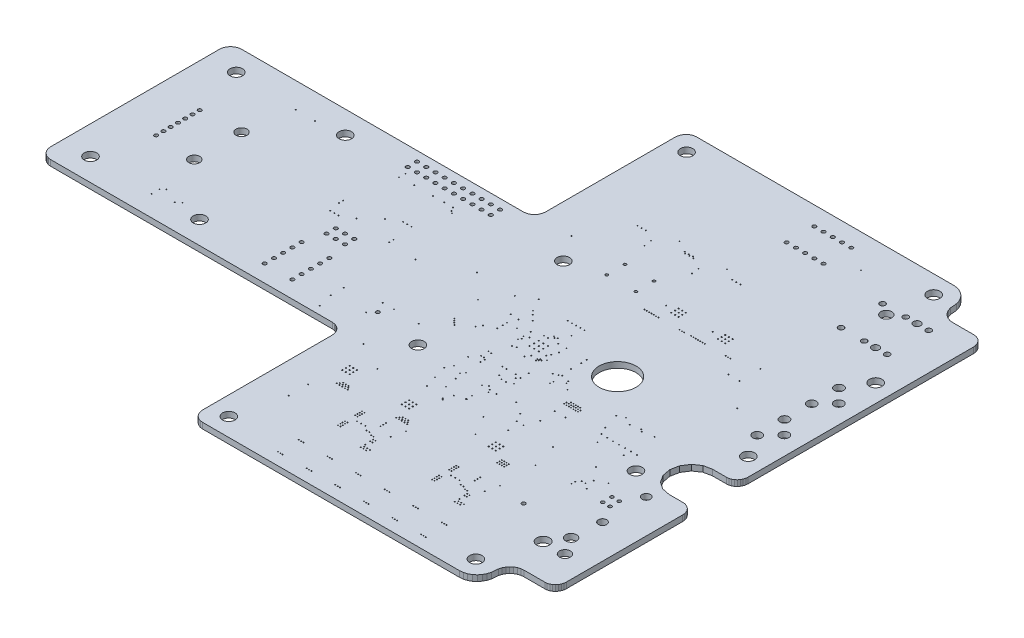
from build123d import *

# Parameters (mm, degrees)
BOARD_OUTLINE_DEPTH = 1.6
SKETCH2_R           = 5.08
SKETCH2_R_2         = 1.15
SKETCH2_R_3         = 1
SKETCH2_R_4         = 1.5
SKETCH2_R_5         = 0.127
SKETCH2_R_6         = 0.508
SKETCH2_R_7         = 0.1905
SKETCH2_R_8         = 1.7145
NPTH_DEPTH          = 116.781160961
SKETCH3_R           = 0.375
SKETCH3_R_2         = 1.75
SKETCH3_R_3         = 1.5
SKETCH3_R_4         = 0.46
SKETCH3_R_5         = 0.75
SKETCH3_R_6         = 1.25
SKETCH3_R_7         = 0.51
SKETCH3_R_8         = 0.5
SKETCH3_R_9         = 0.15
PTH_DEPTH           = 116.781160961


with BuildPart() as part:
    # Sketch1 → Board_Outline (new body)
    with BuildSketch(Plane(origin=(0, 0, 0), x_dir=(1, 0, 0), z_dir=(0, 1, 0))):
        Polygon((90.797031, -59), (91.362359, -58.942359), (91.905959, -58.771641), (92.40695, -58.494409), (92.846069, -58.121319), (93.206441, -57.666709), (93.474219, -57.14805), (93.639131, -56.585269), (93.694809, -56), (93.694809, -24), (93.639131, -23.414731), (93.474219, -22.85195), (93.206441, -22.333291), (92.846069, -21.878681), (92.40695, -21.505591), (91.905959, -21.228359), (91.362359, -21.057641), (90.797031, -21), (86.933319, -21), (84.715459, -20.543281), (82.83525, -19.242641), (81.578931, -17.2961), (81.137769, -15), (81.578931, -12.7039), (82.83525, -10.757359), (84.715459, -9.456719), (86.933319, -9), (90.797031, -9), (91.362359, -8.942359), (91.905959, -8.771641), (92.40695, -8.494409), (92.846069, -8.121319), (93.206441, -7.666709), (93.474219, -7.14805), (93.639131, -6.585269), (93.694809, -6), (93.694809, 56), (93.639131, 56.585269), (93.474219, 57.14805), (93.206441, 57.666709), (92.846069, 58.121319), (92.40695, 58.494409), (91.905959, 58.771641), (91.362359, 58.942359), (90.797031, 59), (85.001469, 59), (84.2477, 59.076859), (83.5229, 59.304481), (82.854909, 59.674119), (82.269419, 60.171569), (81.788919, 60.777719), (81.431881, 61.469269), (81.212009, 62.219641), (81.137769, 63), (81.044969, 63.97545), (80.770141, 64.913419), (80.323831, 65.77785), (79.7232, 66.535531), (78.991341, 67.15735), (78.156359, 67.6194), (77.25035, 67.903931), (76.308141, 68), (5.518331, 68), (4.953, 67.942359), (4.4094, 67.771641), (3.908409, 67.494409), (3.469291, 67.121319), (3.108919, 66.666709), (2.841141, 66.14805), (2.676231, 65.585269), (2.62055, 65), (2.62055, 29.337), (2.516692, 28.54812), (2.212195, 27.813), (1.727811, 27.181739), (1.09655, 26.697355), (0.36143, 26.392858), (-0.42745, 26.289), (-77.978, 26.289), (-78.76688, 26.185142), (-79.502, 25.880645), (-80.133261, 25.396261), (-80.617645, 24.765), (-80.922142, 24.02988), (-81.026, 23.241), (-81.026, -23.241), (-80.922142, -24.02988), (-80.617645, -24.765), (-80.133261, -25.396261), (-79.502, -25.880645), (-78.76688, -26.185142), (-77.978, -26.289), (-0.42745, -26.289), (0.36143, -26.392858), (1.09655, -26.697355), (1.727811, -27.181739), (2.212195, -27.813), (2.516692, -28.54812), (2.62055, -29.337), (2.62055, -65), (2.676231, -65.585269), (2.841141, -66.14805), (3.108919, -66.666709), (3.469291, -67.121319), (3.908409, -67.494409), (4.4094, -67.771641), (4.953, -67.942359), (5.518331, -68), (76.308141, -68), (77.25035, -67.903931), (78.156359, -67.6194), (78.991341, -67.15735), (79.7232, -66.535531), (80.323831, -65.77785), (80.770141, -64.913419), (81.044969, -63.97545), (81.137769, -63), (81.212009, -62.219641), (81.431881, -61.469269), (81.788919, -60.777719), (82.269419, -60.171569), (82.854909, -59.674119), (83.5229, -59.304481), (84.2477, -59.076859), (85.001469, -59), align=None)
    extrude(amount=BOARD_OUTLINE_DEPTH)

    # Sketch2 → NPTH (cut, through all)
    with BuildSketch(Plane(origin=(0, 0, 0), x_dir=(1, 0, 0), z_dir=(0, 1, 0))):
        with Locations((51.786, 0)):
            Circle(SKETCH2_R)
        with Locations((84.391, -36.754)):
            Circle(SKETCH2_R_2)
        with Locations((84.391, -24.714)):
            Circle(SKETCH2_R_2)
        with Locations((80.366, 53.839)):
            Circle(SKETCH2_R_3)
        with Locations((80.366, 42.409)):
            Circle(SKETCH2_R_3)
        with Locations((74.016, 51.709)):
            Circle(SKETCH2_R_4)
        with Locations((29.591, -4.191)):
            Circle(SKETCH2_R_5)
        with Locations((29.972, -7.239)):
            Circle(SKETCH2_R_5)
        with Locations((47.244, -22.225)):
            Circle(SKETCH2_R_5)
        with Locations((29.206, -3.306)):
            Circle(SKETCH2_R_5)
        with Locations((29.174, -1.306)):
            Circle(SKETCH2_R_5)
        with Locations((29.19, -4.806)):
            Circle(SKETCH2_R_5)
        with Locations((34.163, -8.001)):
            Circle(SKETCH2_R_5)
        with Locations((38.136, -5.806)):
            Circle(SKETCH2_R_5)
        with Locations((37.993, -2.306)):
            Circle(SKETCH2_R_5)
        with Locations((38.025, -0.306)):
            Circle(SKETCH2_R_5)
        with Locations((34.417, 0.889)):
            Circle(SKETCH2_R_5)
        with Locations((33.909, 0.508)):
            Circle(SKETCH2_R_5)
        with Locations((33.405, 0.893)):
            Circle(SKETCH2_R_5)
        with Locations((55.753, -35.814)):
            Circle(SKETCH2_R_5)
        with Locations((56.388, -35.814)):
            Circle(SKETCH2_R_5)
        with Locations((55.753, -36.449)):
            Circle(SKETCH2_R_5)
        with Locations((56.388, -36.449)):
            Circle(SKETCH2_R_5)
        with Locations((55.753, -37.084)):
            Circle(SKETCH2_R_5)
        with Locations((56.388, -37.084)):
            Circle(SKETCH2_R_5)
        with Locations((57.023, -37.084)):
            Circle(SKETCH2_R_5)
        with Locations((57.023, -36.449)):
            Circle(SKETCH2_R_5)
        with Locations((57.023, -35.814)):
            Circle(SKETCH2_R_5)
        with Locations((57.658, -35.814)):
            Circle(SKETCH2_R_5)
        with Locations((57.658, -36.449)):
            Circle(SKETCH2_R_5)
        with Locations((57.658, -37.084)):
            Circle(SKETCH2_R_5)
        with Locations((50.8, -43.434)):
            Circle(SKETCH2_R_5)
        with Locations((51.435, -43.434)):
            Circle(SKETCH2_R_5)
        with Locations((50.8, -44.069)):
            Circle(SKETCH2_R_5)
        with Locations((51.435, -44.069)):
            Circle(SKETCH2_R_5)
        with Locations((51.435, -44.704)):
            Circle(SKETCH2_R_5)
        with Locations((50.8, -44.704)):
            Circle(SKETCH2_R_5)
        with Locations((50.8, -45.339)):
            Circle(SKETCH2_R_5)
        with Locations((51.435, -45.339)):
            Circle(SKETCH2_R_5)
        with Locations((61.595, -42.164)):
            Circle(SKETCH2_R_5)
        with Locations((35.687, -42.164)):
            Circle(SKETCH2_R_5)
        with Locations((24.892, -43.434)):
            Circle(SKETCH2_R_5)
        with Locations((25.527, -43.434)):
            Circle(SKETCH2_R_5)
        with Locations((24.892, -44.069)):
            Circle(SKETCH2_R_5)
        with Locations((24.892, -44.704)):
            Circle(SKETCH2_R_5)
        with Locations((24.892, -45.339)):
            Circle(SKETCH2_R_5)
        with Locations((25.527, -44.069)):
            Circle(SKETCH2_R_5)
        with Locations((25.527, -44.704)):
            Circle(SKETCH2_R_5)
        with Locations((25.527, -45.339)):
            Circle(SKETCH2_R_5)
        with Locations((14.732, -40.259)):
            Circle(SKETCH2_R_5)
        with Locations((15.113, -39.751)):
            Circle(SKETCH2_R_5)
        with Locations((15.494, -40.259)):
            Circle(SKETCH2_R_5)
        with Locations((15.875, -39.751)):
            Circle(SKETCH2_R_5)
        with Locations((16.256, -40.259)):
            Circle(SKETCH2_R_5)
        with Locations((16.637, -39.751)):
            Circle(SKETCH2_R_5)
        with Locations((17.018, -40.259)):
            Circle(SKETCH2_R_5)
        with Locations((17.399, -39.751)):
            Circle(SKETCH2_R_5)
        with Locations((17.78, -40.259)):
            Circle(SKETCH2_R_5)
        with Locations((17.018, -39.243)):
            Circle(SKETCH2_R_5)
        with Locations((16.256, -39.243)):
            Circle(SKETCH2_R_5)
        with Locations((15.494, -39.243)):
            Circle(SKETCH2_R_5)
        with Locations((31.115, -40.259)):
            Circle(SKETCH2_R_5)
        with Locations((31.496, -39.751)):
            Circle(SKETCH2_R_5)
        with Locations((31.877, -40.259)):
            Circle(SKETCH2_R_5)
        with Locations((32.258, -39.751)):
            Circle(SKETCH2_R_5)
        with Locations((32.639, -40.259)):
            Circle(SKETCH2_R_5)
        with Locations((33.02, -39.751)):
            Circle(SKETCH2_R_5)
        with Locations((33.401, -40.259)):
            Circle(SKETCH2_R_5)
        with Locations((33.782, -39.751)):
            Circle(SKETCH2_R_5)
        with Locations((34.163, -40.259)):
            Circle(SKETCH2_R_5)
        with Locations((33.401, -39.243)):
            Circle(SKETCH2_R_5)
        with Locations((32.639, -39.243)):
            Circle(SKETCH2_R_5)
        with Locations((31.877, -39.243)):
            Circle(SKETCH2_R_5)
        with Locations((50.419, -24.511)):
            Circle(SKETCH2_R_5)
        with Locations((48.514, -24.511)):
            Circle(SKETCH2_R_5)
        with Locations((11.049, -49.784)):
            Circle(SKETCH2_R_5)
        with Locations((61.087, -51.562)):
            Circle(SKETCH2_R_5)
        with Locations((59.182, -50.927)):
            Circle(SKETCH2_R_5)
        with Locations((59.182, -52.197)):
            Circle(SKETCH2_R_5)
        with Locations((59.563, -51.562)):
            Circle(SKETCH2_R_5)
        with Locations((59.944, -52.197)):
            Circle(SKETCH2_R_5)
        with Locations((60.325, -51.562)):
            Circle(SKETCH2_R_5)
        with Locations((60.706, -52.197)):
            Circle(SKETCH2_R_5)
        with Locations((63.627, -58.928)):
            Circle(SKETCH2_R_5)
        with Locations((62.992, -58.928)):
            Circle(SKETCH2_R_5)
        with Locations((62.357, -58.928)):
            Circle(SKETCH2_R_5)
        with Locations((55.753, -58.928)):
            Circle(SKETCH2_R_5)
        with Locations((55.118, -58.928)):
            Circle(SKETCH2_R_5)
        with Locations((54.483, -58.928)):
            Circle(SKETCH2_R_5)
        with Locations((47.879, -58.928)):
            Circle(SKETCH2_R_5)
        with Locations((47.244, -58.928)):
            Circle(SKETCH2_R_5)
        with Locations((46.609, -58.928)):
            Circle(SKETCH2_R_5)
        with Locations((40.005, -58.928)):
            Circle(SKETCH2_R_5)
        with Locations((39.37, -58.928)):
            Circle(SKETCH2_R_5)
        with Locations((38.735, -58.928)):
            Circle(SKETCH2_R_5)
        with Locations((32.131, -58.928)):
            Circle(SKETCH2_R_5)
        with Locations((31.496, -58.928)):
            Circle(SKETCH2_R_5)
        with Locations((30.861, -58.928)):
            Circle(SKETCH2_R_5)
        with Locations((24.257, -58.928)):
            Circle(SKETCH2_R_5)
        with Locations((23.622, -58.928)):
            Circle(SKETCH2_R_5)
        with Locations((22.987, -58.928)):
            Circle(SKETCH2_R_5)
        with Locations((41.529, 23.622)):
            Circle(SKETCH2_R_5)
        with Locations((39.497, 19.685)):
            Circle(SKETCH2_R_5)
        with Locations((40.132, 19.685)):
            Circle(SKETCH2_R_5)
        with Locations((40.767, 19.685)):
            Circle(SKETCH2_R_5)
        with Locations((41.402, 19.685)):
            Circle(SKETCH2_R_5)
        with Locations((42.037, 19.685)):
            Circle(SKETCH2_R_5)
        with Locations((42.672, 19.685)):
            Circle(SKETCH2_R_5)
        with Locations((43.307, 19.685)):
            Circle(SKETCH2_R_5)
        with Locations((52.197, 19.812)):
            Circle(SKETCH2_R_5)
        with Locations((52.832, 19.812)):
            Circle(SKETCH2_R_5)
        with Locations((53.467, 19.812)):
            Circle(SKETCH2_R_5)
        with Locations((54.102, 19.812)):
            Circle(SKETCH2_R_5)
        with Locations((54.737, 19.812)):
            Circle(SKETCH2_R_5)
        with Locations((55.372, 19.812)):
            Circle(SKETCH2_R_5)
        with Locations((56.007, 19.812)):
            Circle(SKETCH2_R_5)
        with Locations((35.179, -51.562)):
            Circle(SKETCH2_R_5)
        with Locations((33.274, -50.927)):
            Circle(SKETCH2_R_5)
        with Locations((33.274, -52.197)):
            Circle(SKETCH2_R_5)
        with Locations((33.655, -51.562)):
            Circle(SKETCH2_R_5)
        with Locations((34.036, -52.197)):
            Circle(SKETCH2_R_5)
        with Locations((34.417, -51.562)):
            Circle(SKETCH2_R_5)
        with Locations((34.798, -52.197)):
            Circle(SKETCH2_R_5)
        with Locations((-50.8, 19.304)):
            Circle(SKETCH2_R_5)
        with Locations((54.229, 23.749)):
            Circle(SKETCH2_R_5)
        with Locations((57.658, -47.879)):
            Circle(SKETCH2_R_5)
        with Locations((58.293, -47.879)):
            Circle(SKETCH2_R_5)
        with Locations((56.769, -47.371)):
            Circle(SKETCH2_R_5)
        with Locations((56.007, -47.371)):
            Circle(SKETCH2_R_5)
        with Locations((54.737, -46.482)):
            Circle(SKETCH2_R_5)
        with Locations((53.594, -46.482)):
            Circle(SKETCH2_R_5)
        with Locations((52.451, -46.482)):
            Circle(SKETCH2_R_5)
        with Locations((56.896, -44.45)):
            Circle(SKETCH2_R_5)
        with Locations((56.896, -42.926)):
            Circle(SKETCH2_R_5)
        with Locations((56.896, -43.688)):
            Circle(SKETCH2_R_5)
        with Locations((30.988, -42.926)):
            Circle(SKETCH2_R_5)
        with Locations((30.988, -43.688)):
            Circle(SKETCH2_R_5)
        with Locations((30.988, -44.45)):
            Circle(SKETCH2_R_5)
        with Locations((27.686, -46.482)):
            Circle(SKETCH2_R_5)
        with Locations((26.543, -46.482)):
            Circle(SKETCH2_R_5)
        with Locations((28.829, -46.482)):
            Circle(SKETCH2_R_5)
        with Locations((30.099, -47.371)):
            Circle(SKETCH2_R_5)
        with Locations((30.861, -47.371)):
            Circle(SKETCH2_R_5)
        with Locations((31.877, -47.879)):
            Circle(SKETCH2_R_5)
        with Locations((32.512, -47.879)):
            Circle(SKETCH2_R_5)
        with Locations((37.465, 34.798)):
            Circle(SKETCH2_R_5)
        with Locations((31.75, 38.608)):
            Circle(SKETCH2_R_5)
        with Locations((32.893, 38.608)):
            Circle(SKETCH2_R_5)
        with Locations((34.036, 38.608)):
            Circle(SKETCH2_R_5)
        with Locations((44.45, 38.862)):
            Circle(SKETCH2_R_5)
        with Locations((45.593, 38.862)):
            Circle(SKETCH2_R_5)
        with Locations((46.736, 38.862)):
            Circle(SKETCH2_R_5)
        with Locations((24.257, 34.925)):
            Circle(SKETCH2_R_5)
        with Locations((20.828, 38.735)):
            Circle(SKETCH2_R_5)
        with Locations((19.685, 38.735)):
            Circle(SKETCH2_R_5)
        with Locations((18.542, 38.735)):
            Circle(SKETCH2_R_5)
        with Locations((-14.605, 7.366)):
            Circle(SKETCH2_R_5)
        with Locations((-13.462, 7.366)):
            Circle(SKETCH2_R_5)
        with Locations((-12.319, 7.366)):
            Circle(SKETCH2_R_5)
        with Locations((-27.305, 0)):
            Circle(SKETCH2_R_5)
        with Locations((-26.162, 0)):
            Circle(SKETCH2_R_5)
        with Locations((-25.019, 0)):
            Circle(SKETCH2_R_5)
        with Locations((-27.94, 4.191)):
            Circle(SKETCH2_R_5)
        with Locations((-27.94, 3.048)):
            Circle(SKETCH2_R_5)
        with Locations((-11.684, 1.778)):
            Circle(SKETCH2_R_5)
        with Locations((-11.684, 0.635)):
            Circle(SKETCH2_R_5)
        with Locations((-7.112, -20.066)):
            Circle(SKETCH2_R_5)
        with Locations((-7.112, -16.51)):
            Circle(SKETCH2_R_5)
        with Locations((3.429, -17.653)):
            Circle(SKETCH2_R_6)
        with Locations((33.528, 38.989)):
            Circle(SKETCH2_R_5)
        with Locations((32.385, 38.989)):
            Circle(SKETCH2_R_5)
        with Locations((31.242, 38.989)):
            Circle(SKETCH2_R_5)
        with Locations((74.295, -30.988)):
            Circle(SKETCH2_R_5)
        with Locations((43.561, -4.572)):
            Circle(SKETCH2_R_5)
        with Locations((73.279, -28.067)):
            Circle(SKETCH2_R_5)
        with Locations((52.832, -12.573)):
            Circle(SKETCH2_R_5)
        with Locations((52.197, -12.573)):
            Circle(SKETCH2_R_5)
        with Locations((53.467, -12.573)):
            Circle(SKETCH2_R_5)
        with Locations((54.102, -12.573)):
            Circle(SKETCH2_R_5)
        with Locations((51.562, -12.573)):
            Circle(SKETCH2_R_5)
        with Locations((51.562, -13.208)):
            Circle(SKETCH2_R_5)
        with Locations((52.197, -13.208)):
            Circle(SKETCH2_R_5)
        with Locations((52.832, -13.208)):
            Circle(SKETCH2_R_5)
        with Locations((53.467, -13.208)):
            Circle(SKETCH2_R_5)
        with Locations((54.102, -13.208)):
            Circle(SKETCH2_R_5)
        with Locations((54.737, -13.208)):
            Circle(SKETCH2_R_5)
        with Locations((50.927, -13.208)):
            Circle(SKETCH2_R_5)
        with Locations((50.927, -13.843)):
            Circle(SKETCH2_R_5)
        with Locations((51.562, -13.843)):
            Circle(SKETCH2_R_5)
        with Locations((52.197, -13.843)):
            Circle(SKETCH2_R_5)
        with Locations((52.832, -13.843)):
            Circle(SKETCH2_R_5)
        with Locations((53.467, -13.843)):
            Circle(SKETCH2_R_5)
        with Locations((54.102, -13.843)):
            Circle(SKETCH2_R_5)
        with Locations((54.737, -13.843)):
            Circle(SKETCH2_R_5)
        with Locations((49.53, -27.813)):
            Circle(SKETCH2_R_5)
        with Locations((31.623, 6.477)):
            Circle(SKETCH2_R_5)
        with Locations((32.766, 6.477)):
            Circle(SKETCH2_R_5)
        with Locations((33.909, 6.477)):
            Circle(SKETCH2_R_5)
        with Locations((35.052, 6.477)):
            Circle(SKETCH2_R_5)
        with Locations((36.195, 6.477)):
            Circle(SKETCH2_R_5)
        with Locations((24.539, -0.028)):
            Circle(SKETCH2_R_5)
        with Locations((23.749, -2.413)):
            Circle(SKETCH2_R_5)
        with Locations((23.749, -3.556)):
            Circle(SKETCH2_R_5)
        with Locations((23.749, -5.08)):
            Circle(SKETCH2_R_5)
        with Locations((26.396, -2.306)):
            Circle(SKETCH2_R_5)
        with Locations((28.829, -11.811)):
            Circle(SKETCH2_R_5)
        with Locations((33.528, -13.462)):
            Circle(SKETCH2_R_5)
        with Locations((34.671, -13.462)):
            Circle(SKETCH2_R_5)
        with Locations((-54.925, -17.465)):
            Circle(SKETCH2_R_5)
        with Locations((-50.734, -19.365)):
            Circle(SKETCH2_R_5)
        with Locations((24.483, 4.036)):
            Circle(SKETCH2_R_5)
        with Locations((69.088, -43.18)):
            Circle(SKETCH2_R_6)
        with Locations((22.987, -64.643)):
            Circle(SKETCH2_R_5)
        with Locations((23.622, -64.643)):
            Circle(SKETCH2_R_5)
        with Locations((24.257, -64.643)):
            Circle(SKETCH2_R_5)
        with Locations((30.861, -64.643)):
            Circle(SKETCH2_R_5)
        with Locations((31.496, -64.643)):
            Circle(SKETCH2_R_5)
        with Locations((32.131, -64.643)):
            Circle(SKETCH2_R_5)
        with Locations((38.735, -64.643)):
            Circle(SKETCH2_R_5)
        with Locations((39.37, -64.643)):
            Circle(SKETCH2_R_5)
        with Locations((40.005, -64.643)):
            Circle(SKETCH2_R_5)
        with Locations((46.609, -64.643)):
            Circle(SKETCH2_R_5)
        with Locations((47.244, -64.643)):
            Circle(SKETCH2_R_5)
        with Locations((47.879, -64.643)):
            Circle(SKETCH2_R_5)
        with Locations((54.483, -64.643)):
            Circle(SKETCH2_R_5)
        with Locations((55.118, -64.643)):
            Circle(SKETCH2_R_5)
        with Locations((55.753, -64.643)):
            Circle(SKETCH2_R_5)
        with Locations((62.357, -64.643)):
            Circle(SKETCH2_R_5)
        with Locations((62.992, -64.643)):
            Circle(SKETCH2_R_5)
        with Locations((63.627, -64.643)):
            Circle(SKETCH2_R_5)
        with Locations((64.897, -16.002)):
            Circle(SKETCH2_R_5)
        with Locations((66.548, -16.002)):
            Circle(SKETCH2_R_5)
        with Locations((68.199, -16.002)):
            Circle(SKETCH2_R_5)
        with Locations((69.85, -16.002)):
            Circle(SKETCH2_R_5)
        with Locations((71.501, -16.002)):
            Circle(SKETCH2_R_5)
        with Locations((73.152, -16.002)):
            Circle(SKETCH2_R_5)
        with Locations((63.246, -15.875)):
            Circle(SKETCH2_R_5)
        with Locations((29.972, -22.733)):
            Circle(SKETCH2_R_5)
        with Locations((25.781, -21.717)):
            Circle(SKETCH2_R_5)
        with Locations((29.972, -19.939)):
            Circle(SKETCH2_R_5)
        with Locations((37.211, -13.462)):
            Circle(SKETCH2_R_5)
        with Locations((36.449, -16.637)):
            Circle(SKETCH2_R_5)
        with Locations((37.719, -16.637)):
            Circle(SKETCH2_R_5)
        with Locations((39.243, -16.002)):
            Circle(SKETCH2_R_5)
        with Locations((35.179, -16.002)):
            Circle(SKETCH2_R_5)
        with Locations((35.179, -20.701)):
            Circle(SKETCH2_R_5)
        with Locations((37.338, -20.701)):
            Circle(SKETCH2_R_5)
        with Locations((37.719, -21.463)):
            Circle(SKETCH2_R_5)
        with Locations((39.243, -20.828)):
            Circle(SKETCH2_R_5)
        with Locations((21.082, -6.35)):
            Circle(SKETCH2_R_5)
        with Locations((20.32, -7.62)):
            Circle(SKETCH2_R_5)
        with Locations((22.225, 0.127)):
            Circle(SKETCH2_R_5)
        with Locations((43.307, -7.747)):
            Circle(SKETCH2_R_5)
        with Locations((43.942, -7.366)):
            Circle(SKETCH2_R_5)
        with Locations((43.561, -0.254)):
            Circle(SKETCH2_R_5)
        with Locations((43.561, -1.778)):
            Circle(SKETCH2_R_5)
        with Locations((-56.134, 19.304)):
            Circle(SKETCH2_R_5)
        with Locations((11.049, -44.45)):
            Circle(SKETCH2_R_5)
        with Locations((42.926, -28.067)):
            Circle(SKETCH2_R_5)
        with Locations((9.017, -27.178)):
            Circle(SKETCH2_R_5)
        with Locations((26.797, -25.273)):
            Circle(SKETCH2_R_5)
        with Locations((66.548, 15.748)):
            Circle(SKETCH2_R_5)
        with Locations((69.596, 15.748)):
            Circle(SKETCH2_R_5)
        with Locations((61.595, -32.385)):
            Circle(SKETCH2_R_5)
        with Locations((14.224, -0.889)):
            Circle(SKETCH2_R_5)
        with Locations((18.415, 5.08)):
            Circle(SKETCH2_R_5)
        with Locations((75.819, 8.89)):
            Circle(SKETCH2_R_5)
        with Locations((59.944, 58.801)):
            Circle(SKETCH2_R_5)
        with Locations((42.164, -8.255)):
            Circle(SKETCH2_R_5)
        with Locations((11.811, -14.732)):
            Circle(SKETCH2_R_5)
        with Locations((46.355, -8.636)):
            Circle(SKETCH2_R_5)
        with Locations((60.96, -9.525)):
            Circle(SKETCH2_R_5)
        with Locations((1.905, -19.304)):
            Circle(SKETCH2_R_5)
        with Locations((16.891, -31.242)):
            Circle(SKETCH2_R_5)
        with Locations((71.247, -9.271)):
            Circle(SKETCH2_R_5)
        with Locations((67.564, -9.271)):
            Circle(SKETCH2_R_5)
        with Locations((70.358, -24.511)):
            Circle(SKETCH2_R_5)
        with Locations((51.689, -21.209)):
            Circle(SKETCH2_R_5)
        with Locations((30.341, -2.806)):
            Circle(SKETCH2_R_5)
        with Locations((30.905, -6.858)):
            Circle(SKETCH2_R_5)
        with Locations((34.889, -6.858)):
            Circle(SKETCH2_R_5)
        with Locations((36.937, -4.806)):
            Circle(SKETCH2_R_5)
        with Locations((35.762, -0.329)):
            Circle(SKETCH2_R_5)
        with Locations((31.905, -0.353)):
            Circle(SKETCH2_R_5)
        with Locations((54.328, -16.919)):
            Circle(SKETCH2_R_5)
        with Locations((43.942, -20.066)):
            Circle(SKETCH2_R_5)
        with Locations((51.336, -16.863)):
            Circle(SKETCH2_R_5)
        with Locations((37.084, -6.985)):
            Circle(SKETCH2_R_5)
        with Locations((36.576, -6.858)):
            Circle(SKETCH2_R_5)
        with Locations((36.957, -6.477)):
            Circle(SKETCH2_R_5)
        with Locations((37.465, -6.604)):
            Circle(SKETCH2_R_5)
        with Locations((36.703, -7.366)):
            Circle(SKETCH2_R_5)
        with Locations((26.67, -19.939)):
            Circle(SKETCH2_R_5)
        with Locations((33.782, -27.051)):
            Circle(SKETCH2_R_5)
        with Locations((36.322, -19.939)):
            Circle(SKETCH2_R_5)
        with Locations((36.322, -26.162)):
            Circle(SKETCH2_R_7)
        with Locations((36.322, -24.638)):
            Circle(SKETCH2_R_5)
        with Locations((71.374, -17.907)):
            Circle(SKETCH2_R_5)
        with Locations((32.893, -29.21)):
            Circle(SKETCH2_R_5)
        with Locations((33.274, -29.591)):
            Circle(SKETCH2_R_5)
        with Locations((30.607, -26.035)):
            Circle(SKETCH2_R_5)
        with Locations((1.905, -14.732)):
            Circle(SKETCH2_R_5)
        with Locations((4.953, -14.732)):
            Circle(SKETCH2_R_5)
        with Locations((59.69, -25.654)):
            Circle(SKETCH2_R_5)
        with Locations((44.069, -10.922)):
            Circle(SKETCH2_R_5)
        with Locations((38.1, -14.351)):
            Circle(SKETCH2_R_5)
        with Locations((44.196, -10.033)):
            Circle(SKETCH2_R_5)
        with Locations((38.735, -13.716)):
            Circle(SKETCH2_R_5)
        with Locations((33.02, -0.381)):
            Circle(SKETCH2_R_5)
        with Locations((27.94, -11.684)):
            Circle(SKETCH2_R_5)
        with Locations((26.543, -15.875)):
            Circle(SKETCH2_R_5)
        with Locations((29.276, -20.889)):
            Circle(SKETCH2_R_5)
        with Locations((26.797, 1.651)):
            Circle(SKETCH2_R_5)
        with Locations((25.4, 3.048)):
            Circle(SKETCH2_R_5)
        with Locations((35.687, 3.429)):
            Circle(SKETCH2_R_5)
        with Locations((7.62, 5.461)):
            Circle(SKETCH2_R_5)
        with Locations((-3.937, 0.127)):
            Circle(SKETCH2_R_5)
        with Locations((-49.53, -18.415)):
            Circle(SKETCH2_R_5)
        with Locations((46.101, -7.874)):
            Circle(SKETCH2_R_5)
        with Locations((48.006, -10.033)):
            Circle(SKETCH2_R_5)
        with Locations((-6.096, -24.13)):
            Circle(SKETCH2_R_5)
        with Locations((-55.88, -20.574)):
            Circle(SKETCH2_R_5)
        with Locations((-55.88, -18.415)):
            Circle(SKETCH2_R_5)
        with Locations((62.738, -8.636)):
            Circle(SKETCH2_R_5)
        with Locations((28.829, -13.843)):
            Circle(SKETCH2_R_5)
        with Locations((-13.589, 17.653)):
            Circle(SKETCH2_R_5)
        with Locations((28.067, -13.843)):
            Circle(SKETCH2_R_5)
        with Locations((29.464, -14.224)):
            Circle(SKETCH2_R_5)
        with Locations((-16.637, 17.653)):
            Circle(SKETCH2_R_5)
        with Locations((29.464, -15.367)):
            Circle(SKETCH2_R_5)
        with Locations((-21.844, 17.653)):
            Circle(SKETCH2_R_5)
        with Locations((68.199, -9.779)):
            Circle(SKETCH2_R_5)
        with Locations((62.23, -13.843)):
            Circle(SKETCH2_R_5)
        with Locations((15.494, -8.636)):
            Circle(SKETCH2_R_5)
        with Locations((-9.906, 16.129)):
            Circle(SKETCH2_R_5)
        with Locations((-25.781, 17.399)):
            Circle(SKETCH2_R_5)
        with Locations((16.002, -9.144)):
            Circle(SKETCH2_R_5)
        with Locations((-10.541, 16.637)):
            Circle(SKETCH2_R_5)
        with Locations((-25.781, 19.177)):
            Circle(SKETCH2_R_5)
        with Locations((16.51, -9.652)):
            Circle(SKETCH2_R_5)
        with Locations((-11.176, 17.653)):
            Circle(SKETCH2_R_5)
        with Locations((17.018, -10.16)):
            Circle(SKETCH2_R_5)
        with Locations((33.147, -48.641)):
            Circle(SKETCH2_R_5)
        with Locations((33.147, -49.403)):
            Circle(SKETCH2_R_5)
        with Locations((33.782, -49.403)):
            Circle(SKETCH2_R_5)
        with Locations((33.782, -48.641)):
            Circle(SKETCH2_R_5)
        with Locations((34.925, -45.593)):
            Circle(SKETCH2_R_5)
        with Locations((24.892, -48.133)):
            Circle(SKETCH2_R_5)
        with Locations((25.527, -48.133)):
            Circle(SKETCH2_R_5)
        with Locations((25.527, -48.768)):
            Circle(SKETCH2_R_5)
        with Locations((25.527, -49.403)):
            Circle(SKETCH2_R_5)
        with Locations((25.527, -50.038)):
            Circle(SKETCH2_R_5)
        with Locations((24.892, -50.038)):
            Circle(SKETCH2_R_5)
        with Locations((24.892, -49.403)):
            Circle(SKETCH2_R_5)
        with Locations((24.892, -48.768)):
            Circle(SKETCH2_R_5)
        with Locations((59.055, -48.641)):
            Circle(SKETCH2_R_5)
        with Locations((59.69, -48.641)):
            Circle(SKETCH2_R_5)
        with Locations((59.055, -49.403)):
            Circle(SKETCH2_R_5)
        with Locations((59.69, -49.403)):
            Circle(SKETCH2_R_5)
        with Locations((60.833, -45.593)):
            Circle(SKETCH2_R_5)
        with Locations((50.8, -50.038)):
            Circle(SKETCH2_R_5)
        with Locations((51.435, -50.038)):
            Circle(SKETCH2_R_5)
        with Locations((50.8, -49.403)):
            Circle(SKETCH2_R_5)
        with Locations((51.435, -49.403)):
            Circle(SKETCH2_R_5)
        with Locations((51.435, -48.768)):
            Circle(SKETCH2_R_5)
        with Locations((50.8, -48.768)):
            Circle(SKETCH2_R_5)
        with Locations((50.8, -48.133)):
            Circle(SKETCH2_R_5)
        with Locations((51.435, -48.133)):
            Circle(SKETCH2_R_5)
        with Locations((11.938, 27.178)):
            Circle(SKETCH2_R_5)
        with Locations((-73.223, 20.066)):
            Circle(SKETCH2_R_8)
        with Locations((-43.223, 20.066)):
            Circle(SKETCH2_R_8)
        with Locations((-73.223, -20.066)):
            Circle(SKETCH2_R_8)
        with Locations((-43.223, -20.066)):
            Circle(SKETCH2_R_8)
        with Locations((16.773, 20.066)):
            Circle(SKETCH2_R_8)
        with Locations((16.773, -19.939)):
            Circle(SKETCH2_R_8)
        with Locations((7.773, -62.992)):
            Circle(SKETCH2_R_8)
        with Locations((75.773, -62.992)):
            Circle(SKETCH2_R_8)
        with Locations((76.773, -19.939)):
            Circle(SKETCH2_R_8)
        with Locations((7.773, 62.992)):
            Circle(SKETCH2_R_8)
        with Locations((75.773, 62.992)):
            Circle(SKETCH2_R_8)
        with Locations((88.773, 34.036)):
            Circle(SKETCH2_R_8)
        with Locations((88.773, -1.016)):
            Circle(SKETCH2_R_8)
        with Locations((22.479, 7.62)):
            Circle(SKETCH2_R_5)
        with Locations((45.974, -33.274)):
            Circle(SKETCH2_R_5)
        with Locations((27.813, -28.448)):
            Circle(SKETCH2_R_5)
        with Locations((64.643, -18.415)):
            Circle(SKETCH2_R_5)
        with Locations((38.735, -11.43)):
            Circle(SKETCH2_R_5)
        with Locations((71.755, -29.845)):
            Circle(SKETCH2_R_5)
        with Locations((70.993, -30.861)):
            Circle(SKETCH2_R_5)
        with Locations((72.771, -29.845)):
            Circle(SKETCH2_R_5)
        with Locations((70.993, -31.877)):
            Circle(SKETCH2_R_5)
        with Locations((64.897, -9.779)):
            Circle(SKETCH2_R_5)
        with Locations((37.465, -3.937)):
            Circle(SKETCH2_R_5)
        with Locations((75.946, -26.67)):
            Circle(SKETCH2_R_5)
        with Locations((49.149, 19.685)):
            Circle(SKETCH2_R_5)
        with Locations((50.419, 19.685)):
            Circle(SKETCH2_R_5)
        with Locations((37.211, 36.83)):
            Circle(SKETCH2_R_5)
        with Locations((24.003, 36.957)):
            Circle(SKETCH2_R_5)
        with Locations((-17.78, 5.588)):
            Circle(SKETCH2_R_5)
        with Locations((49.784, 19.685)):
            Circle(SKETCH2_R_5)
        with Locations((69.596, 21.463)):
            Circle(SKETCH2_R_5)
        with Locations((61.722, 19.812)):
            Circle(SKETCH2_R_5)
        with Locations((62.992, 19.812)):
            Circle(SKETCH2_R_5)
        with Locations((41.275, 40.64)):
            Circle(SKETCH2_R_5)
        with Locations((-21.844, 1.778)):
            Circle(SKETCH2_R_5)
        with Locations((62.357, 19.812)):
            Circle(SKETCH2_R_5)
        with Locations((28.067, 40.767)):
            Circle(SKETCH2_R_5)
    extrude(amount=NPTH_DEPTH, mode=Mode.SUBTRACT)

    # Sketch3 → PTH (cut, through all)
    with BuildSketch(Plane(origin=(0, 0, 0), x_dir=(1, 0, 0), z_dir=(0, 1, 0))):
        with Locations((26.04, 22.77)):
            Circle(SKETCH3_R)
        with Locations((26.04, 27.77)):
            Circle(SKETCH3_R)
        with Locations((34.04, 22.77)):
            Circle(SKETCH3_R)
        with Locations((34.04, 27.77)):
            Circle(SKETCH3_R)
        with Locations((80.82, -49.53)):
            Circle(SKETCH3_R_2)
        with Locations((86.82, -49.53)):
            Circle(SKETCH3_R_3)
        with Locations((83.82, -44.83)):
            Circle(SKETCH3_R_3)
        with Locations((79.68, -29.48)):
            Circle(SKETCH3_R_4)
        with Locations((79.68, -31.98)):
            Circle(SKETCH3_R_4)
        with Locations((81.68, -31.98)):
            Circle(SKETCH3_R_4)
        with Locations((81.68, -29.48)):
            Circle(SKETCH3_R_4)
        with Locations((77.22, 53.84)):
            Circle(SKETCH3_R_5)
        with Locations((77.22, 42.41)):
            Circle(SKETCH3_R_5)
        with Locations((83.57, 53.84)):
            Circle(SKETCH3_R_5)
        with Locations((83.57, 42.41)):
            Circle(SKETCH3_R_5)
        with Locations((70.87, 53.84)):
            Circle(SKETCH3_R_5)
        with Locations((70.87, 42.41)):
            Circle(SKETCH3_R_5)
        with Locations((84.95, 27.76)):
            Circle(SKETCH3_R_6)
        with Locations((88.65, 24.01)):
            Circle(SKETCH3_R_6)
        with Locations((84.95, 20.26)):
            Circle(SKETCH3_R_6)
        with Locations((84.95, 12.76)):
            Circle(SKETCH3_R_6)
        with Locations((88.65, 9.01)):
            Circle(SKETCH3_R_6)
        with Locations((84.95, 5.26)):
            Circle(SKETCH3_R_6)
        with Locations((-22.35, -5.97)):
            Circle(SKETCH3_R_7)
        with Locations((-22.35, -3.43)):
            Circle(SKETCH3_R_7)
        with Locations((-19.81, -5.97)):
            Circle(SKETCH3_R_7)
        with Locations((-19.81, -3.43)):
            Circle(SKETCH3_R_7)
        with Locations((-17.27, -5.97)):
            Circle(SKETCH3_R_7)
        with Locations((-17.27, -3.43)):
            Circle(SKETCH3_R_7)
        with Locations((-27.05, 21.08)):
            Circle(SKETCH3_R_7)
        with Locations((-27.05, 23.62)):
            Circle(SKETCH3_R_7)
        with Locations((-24.51, 21.08)):
            Circle(SKETCH3_R_7)
        with Locations((-24.51, 23.62)):
            Circle(SKETCH3_R_7)
        with Locations((-21.97, 21.08)):
            Circle(SKETCH3_R_7)
        with Locations((-21.97, 23.62)):
            Circle(SKETCH3_R_7)
        with Locations((-19.43, 21.08)):
            Circle(SKETCH3_R_7)
        with Locations((-19.43, 23.62)):
            Circle(SKETCH3_R_7)
        with Locations((-16.89, 21.08)):
            Circle(SKETCH3_R_7)
        with Locations((-16.89, 23.62)):
            Circle(SKETCH3_R_7)
        with Locations((-14.35, 21.08)):
            Circle(SKETCH3_R_7)
        with Locations((-14.35, 23.62)):
            Circle(SKETCH3_R_7)
        with Locations((-11.81, 21.08)):
            Circle(SKETCH3_R_7)
        with Locations((-11.81, 23.62)):
            Circle(SKETCH3_R_7)
        with Locations((-9.27, 21.08)):
            Circle(SKETCH3_R_7)
        with Locations((-9.27, 23.62)):
            Circle(SKETCH3_R_7)
        with Locations((-6.73, 21.08)):
            Circle(SKETCH3_R_7)
        with Locations((-6.73, 23.62)):
            Circle(SKETCH3_R_7)
        with Locations((-4.19, 21.08)):
            Circle(SKETCH3_R_7)
        with Locations((-4.19, 23.62)):
            Circle(SKETCH3_R_7)
        with Locations((-16.13, -21.59)):
            Circle(SKETCH3_R_8)
        with Locations((-16.13, -19.05)):
            Circle(SKETCH3_R_8)
        with Locations((-16.13, -16.51)):
            Circle(SKETCH3_R_8)
        with Locations((-16.13, -13.97)):
            Circle(SKETCH3_R_8)
        with Locations((-16.13, -11.43)):
            Circle(SKETCH3_R_8)
        with Locations((-23.75, -11.43)):
            Circle(SKETCH3_R_8)
        with Locations((-23.75, -13.97)):
            Circle(SKETCH3_R_8)
        with Locations((-23.75, -16.51)):
            Circle(SKETCH3_R_8)
        with Locations((-23.75, -19.05)):
            Circle(SKETCH3_R_8)
        with Locations((-23.75, -21.59)):
            Circle(SKETCH3_R_8)
        with Locations((53.21, 62.87)):
            Circle(SKETCH3_R_8)
        with Locations((50.67, 62.87)):
            Circle(SKETCH3_R_8)
        with Locations((48.13, 62.87)):
            Circle(SKETCH3_R_8)
        with Locations((45.59, 62.87)):
            Circle(SKETCH3_R_8)
        with Locations((43.05, 62.87)):
            Circle(SKETCH3_R_8)
        with Locations((43.05, 55.25)):
            Circle(SKETCH3_R_8)
        with Locations((45.59, 55.25)):
            Circle(SKETCH3_R_8)
        with Locations((48.13, 55.25)):
            Circle(SKETCH3_R_8)
        with Locations((50.67, 55.25)):
            Circle(SKETCH3_R_8)
        with Locations((53.21, 55.25)):
            Circle(SKETCH3_R_8)
        with Locations((32.38, -2.29)):
            Circle(SKETCH3_R_9)
        with Locations((33.66, -2.29)):
            Circle(SKETCH3_R_9)
        with Locations((34.93, -2.29)):
            Circle(SKETCH3_R_9)
        with Locations((32.38, -3.56)):
            Circle(SKETCH3_R_9)
        with Locations((33.66, -3.56)):
            Circle(SKETCH3_R_9)
        with Locations((34.93, -3.56)):
            Circle(SKETCH3_R_9)
        with Locations((32.38, -4.83)):
            Circle(SKETCH3_R_9)
        with Locations((33.66, -4.83)):
            Circle(SKETCH3_R_9)
        with Locations((34.93, -4.83)):
            Circle(SKETCH3_R_9)
        with Locations((29.72, -35.31)):
            Circle(SKETCH3_R_9)
        with Locations((30.72, -35.31)):
            Circle(SKETCH3_R_9)
        with Locations((28.72, -35.31)):
            Circle(SKETCH3_R_9)
        with Locations((28.72, -36.31)):
            Circle(SKETCH3_R_9)
        with Locations((29.72, -36.31)):
            Circle(SKETCH3_R_9)
        with Locations((30.72, -36.31)):
            Circle(SKETCH3_R_9)
        with Locations((30.72, -34.31)):
            Circle(SKETCH3_R_9)
        with Locations((29.72, -34.31)):
            Circle(SKETCH3_R_9)
        with Locations((28.72, -34.31)):
            Circle(SKETCH3_R_9)
        with Locations((51.69, -33.4)):
            Circle(SKETCH3_R_9)
        with Locations((51.69, -34.4)):
            Circle(SKETCH3_R_9)
        with Locations((51.69, -32.4)):
            Circle(SKETCH3_R_9)
        with Locations((50.69, -32.4)):
            Circle(SKETCH3_R_9)
        with Locations((50.69, -33.4)):
            Circle(SKETCH3_R_9)
        with Locations((50.69, -34.4)):
            Circle(SKETCH3_R_9)
        with Locations((52.69, -34.4)):
            Circle(SKETCH3_R_9)
        with Locations((52.69, -33.4)):
            Circle(SKETCH3_R_9)
        with Locations((52.69, -32.4)):
            Circle(SKETCH3_R_9)
        with Locations((13.34, -35.31)):
            Circle(SKETCH3_R_9)
        with Locations((14.34, -35.31)):
            Circle(SKETCH3_R_9)
        with Locations((12.34, -35.31)):
            Circle(SKETCH3_R_9)
        with Locations((12.34, -36.31)):
            Circle(SKETCH3_R_9)
        with Locations((13.34, -36.31)):
            Circle(SKETCH3_R_9)
        with Locations((14.34, -36.31)):
            Circle(SKETCH3_R_9)
        with Locations((14.34, -34.31)):
            Circle(SKETCH3_R_9)
        with Locations((13.34, -34.31)):
            Circle(SKETCH3_R_9)
        with Locations((12.34, -34.31)):
            Circle(SKETCH3_R_9)
        with Locations((44.96, 23.62)):
            Circle(SKETCH3_R_9)
        with Locations((44.96, 22.62)):
            Circle(SKETCH3_R_9)
        with Locations((44.96, 24.62)):
            Circle(SKETCH3_R_9)
        with Locations((43.96, 24.62)):
            Circle(SKETCH3_R_9)
        with Locations((43.96, 23.62)):
            Circle(SKETCH3_R_9)
        with Locations((43.96, 22.62)):
            Circle(SKETCH3_R_9)
        with Locations((45.96, 22.62)):
            Circle(SKETCH3_R_9)
        with Locations((45.96, 23.62)):
            Circle(SKETCH3_R_9)
        with Locations((45.96, 24.62)):
            Circle(SKETCH3_R_9)
        with Locations((57.66, 23.75)):
            Circle(SKETCH3_R_9)
        with Locations((57.66, 22.75)):
            Circle(SKETCH3_R_9)
        with Locations((57.66, 24.75)):
            Circle(SKETCH3_R_9)
        with Locations((56.66, 24.75)):
            Circle(SKETCH3_R_9)
        with Locations((56.66, 23.75)):
            Circle(SKETCH3_R_9)
        with Locations((56.66, 22.75)):
            Circle(SKETCH3_R_9)
        with Locations((58.66, 22.75)):
            Circle(SKETCH3_R_9)
        with Locations((58.66, 23.75)):
            Circle(SKETCH3_R_9)
        with Locations((58.66, 24.75)):
            Circle(SKETCH3_R_9)
        with Locations((-69.22, 6)):
            Circle(SKETCH3_R_8)
        with Locations((-69.22, -6)):
            Circle(SKETCH3_R_8)
        with Locations((-69.22, 0)):
            Circle(SKETCH3_R_8)
        with Locations((-69.22, 4)):
            Circle(SKETCH3_R_8)
        with Locations((-58.22, -6.5)):
            Circle(SKETCH3_R_3)
        with Locations((-58.22, 6.5)):
            Circle(SKETCH3_R_3)
        with Locations((-69.22, -4)):
            Circle(SKETCH3_R_8)
        with Locations((-69.22, -2)):
            Circle(SKETCH3_R_8)
        with Locations((-69.22, 2)):
            Circle(SKETCH3_R_8)
    extrude(amount=PTH_DEPTH, mode=Mode.SUBTRACT)


solid = part.part
